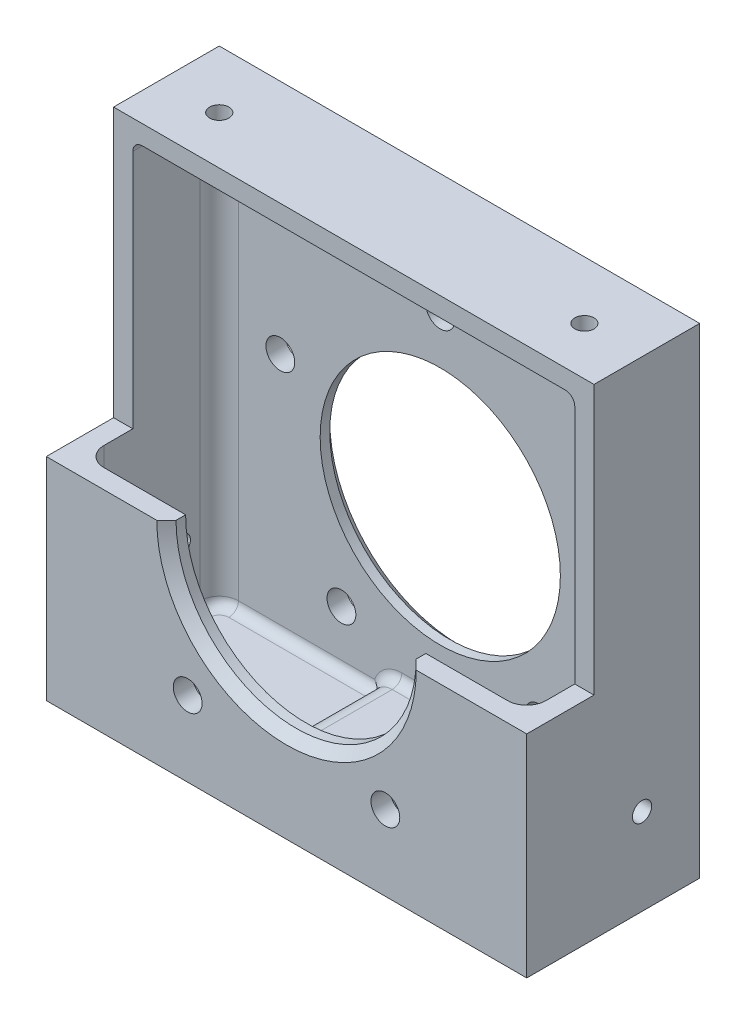
from build123d import *

# Parameters (mm, degrees)
SKETCH1_W          = 50
SKETCH1_H          = 50
MAIN_DEPTH         = 18
SKETCH2_W          = 7
SKETCH2_H          = 28
CUT_EXTRUDE1_DEPTH = 73.965745388
SHELL1_T           = -2
RIB1_REACH         = 72.285
SKETCH11_WALLS_W   = 12
SKETCH11_WALLS_H   = 158.570267126
SKETCH3_R          = 12.5
CUT_EXTRUDE2_DEPTH = 73.965745388
CHAMFER1_SIZE      = 1
CUT_EXTRUDE3_REACH = 74.966
SKETCH4_R          = 1
SKETCH6_R          = 1
CUT_EXTRUDE4_DEPTH = 73.965745388
CUT_EXTRUDE7_REACH = 74.966
SKETCH9_R          = 1.5
CIRPATTERN1_COUNT  = 5
CUT_EXTRUDE8_REACH = 74.966
SKETCH13_R         = 1.5
FILLET1_R          = 2
FILLET2_R          = 2
FILLET3_R          = 1


# Some blends are built 0.0001 mm under size
with BuildPart() as part:
    # Sketch1 → main (new body)
    with BuildSketch(Plane.XY):
        with Locations((25, 25)):
            Rectangle(SKETCH1_W, SKETCH1_H)
    extrude(amount=MAIN_DEPTH)

    # Sketch2 → Cut-Extrude1 (cut, through all)
    with BuildSketch(Plane(origin=(50, 0, 0), x_dir=(0, 0, -1), z_dir=(1, 0, 0))):
        with Locations((-14.5, 36)):
            Rectangle(SKETCH2_W, SKETCH2_H)
    extrude(amount=-CUT_EXTRUDE1_DEPTH, mode=Mode.SUBTRACT)

    # Shell1
    shell1_openings = [part.faces().sort_by_distance(p)[0] for p in [
        (25, 36, 11),
        (25, 22, 14.5),
    ]]
    offset(amount=SHELL1_T, openings=shell1_openings, kind=Kind.INTERSECTION)

    # Sketch11 walls → Rib1 (add, up to next)
    with BuildSketch(Plane(origin=(0, 4, 0), x_dir=(-1, 0, 0), z_dir=(0, 1, 0)), mode=Mode.PRIVATE) as rib1_sk1:
        with Locations((-25, 8)):
            Rectangle(SKETCH11_WALLS_W, SKETCH11_WALLS_H)
    rib1_tool1 = extrude(rib1_sk1.sketch, amount=-RIB1_REACH, mode=Mode.PRIVATE) - part.part
    add(rib1_tool1.solids().sort_by_distance((25, 4, 8))[0])

    # Sketch3 → Cut-Extrude2 (cut, through all)
    with BuildSketch(Plane.XY.offset(18)):
        with Locations((25, 22)):
            Circle(SKETCH3_R)
    extrude(amount=-CUT_EXTRUDE2_DEPTH, mode=Mode.SUBTRACT)

    # Chamfer1
    chamfer1_edges = [part.edges().sort_by_distance(p)[0] for p in [
        (12.5, 22, 0),
        (25, 9.5, 18),
    ]]
    chamfer(chamfer1_edges, length=CHAMFER1_SIZE)

    # Sketch4 → Cut-Extrude3 (cut, up to next)
    with BuildSketch(Plane(origin=(0, 50, 0), x_dir=(-1, 0, 0), z_dir=(0, 1, 0)), mode=Mode.PRIVATE) as cut_extrude3_sk1:
        with Locations((-44, 6)):
            Circle(SKETCH4_R)
    cut_extrude3_tool1 = extrude(cut_extrude3_sk1.sketch, amount=-CUT_EXTRUDE3_REACH, mode=Mode.PRIVATE) & part.part
    # Sketch4 → Cut-Extrude3 (cut, up to next)
    with BuildSketch(Plane(origin=(0, 50, 0), x_dir=(-1, 0, 0), z_dir=(0, 1, 0)), mode=Mode.PRIVATE) as cut_extrude3_sk2:
        with Locations(Location((-6, 6, 0), (0, 0, 180))):
            Circle(SKETCH4_R)
    cut_extrude3_tool2 = extrude(cut_extrude3_sk2.sketch, amount=-CUT_EXTRUDE3_REACH, mode=Mode.PRIVATE) & part.part
    add(cut_extrude3_tool1.solids().sort_by_distance((44, 50, 6))[0], mode=Mode.SUBTRACT)
    add(cut_extrude3_tool2.solids().sort_by_distance((6, 50, 6))[0], mode=Mode.SUBTRACT)

    # Sketch6 → Cut-Extrude4 (cut, through all)
    with BuildSketch(Plane(origin=(50, 0, 0), x_dir=(0, 0, -1), z_dir=(1, 0, 0))):
        with Locations(Location((-6, 9, 0), (0, 0, 90))):
            Circle(SKETCH6_R)
    extrude(amount=-CUT_EXTRUDE4_DEPTH, mode=Mode.SUBTRACT)

    # Sketch9 → Cut-Extrude7 (cut, up to next)
    with BuildSketch(Plane(origin=(0, 0, 0), x_dir=(-1, 0, 0), z_dir=(0, 0, -1)), mode=Mode.PRIVATE) as cut_extrude7_sk1:
        with Locations((-25, 39.5)):
            Circle(SKETCH9_R)
    cut_extrude7_tool1 = extrude(cut_extrude7_sk1.sketch, amount=-CUT_EXTRUDE7_REACH, mode=Mode.PRIVATE) & part.part
    cut_extrude7 = cut_extrude7_tool1.solids().sort_by_distance((25, 39.5, 0))[0]
    add(cut_extrude7, mode=Mode.SUBTRACT)

    # CirPattern1: Cut-Extrude7 ×5 about axis
    cirpattern1_axis = Axis((25, 22, 0), (0, 0, 1))
    for i in range(1, CIRPATTERN1_COUNT):
        add(cut_extrude7.rotate(cirpattern1_axis, i * 360 / CIRPATTERN1_COUNT), mode=Mode.SUBTRACT)

    # Sketch13 → Cut-Extrude8 (cut, up to next)
    with BuildSketch(Plane.XY.offset(18), mode=Mode.PRIVATE) as cut_extrude8_sk1:
        with Locations(Location((35.286241915, 7.842202598, 0), (0, 0, 180))):
            Circle(SKETCH13_R)
    cut_extrude8_tool1 = extrude(cut_extrude8_sk1.sketch, amount=-CUT_EXTRUDE8_REACH, mode=Mode.PRIVATE) & part.part
    # Sketch13 → Cut-Extrude8 (cut, up to next)
    with BuildSketch(Plane.XY.offset(18), mode=Mode.PRIVATE) as cut_extrude8_sk2:
        with Locations(Location((14.713758085, 7.842202598, 0), (0, 0, 180))):
            Circle(SKETCH13_R)
    cut_extrude8_tool2 = extrude(cut_extrude8_sk2.sketch, amount=-CUT_EXTRUDE8_REACH, mode=Mode.PRIVATE) & part.part
    add(cut_extrude8_tool1.solids().sort_by_distance((35.286242, 7.842203, 18))[0], mode=Mode.SUBTRACT)
    add(cut_extrude8_tool2.solids().sort_by_distance((14.713758, 7.842203, 18))[0], mode=Mode.SUBTRACT)

    # Fillet1
    fillet1_edges = [part.edges().sort_by_distance(p)[0] for p in [
        (2, 12, 16),
        (48, 12, 16),
        (2, 25, 2),
        (48, 25, 2),
    ]]
    fillet(fillet1_edges, radius=FILLET1_R)

    # Fillet2
    fillet2_edges = [part.edges().sort_by_distance(p)[0] for p in [
        (31, 4, 9),
        (19, 4, 9),
    ]]
    fillet(fillet2_edges, radius=FILLET2_R - 0.0001)  # a hair under: the kernel refuses the full size

    # Fillet3
    # the kernel refuses this fillet: 1 mm, written as the material it adds along each edge
    with BuildSketch(Plane(origin=(48, 2, 4), x_dir=(-1, 0, 0), z_dir=(0, 0, 1)), Plane(origin=(2, 2, 14), x_dir=(1, 0, 0), z_dir=(0, 0, -1))) as fillet3_piece_1:
        with BuildLine():
            CenterArc((FILLET3_R, -FILLET3_R), FILLET3_R, 90, 90)
            Line((0, -FILLET3_R), (0, 0))
            Line((0, 0), (FILLET3_R, 0))
        make_face()
    extrude(amount=10)
    with BuildSketch(Plane(origin=(46, 2, 14), x_dir=(1, 0, 0), z_dir=(0, 0, -1))) as fillet3_piece_2:
        with BuildLine():
            CenterArc((2 - FILLET3_R, -FILLET3_R), FILLET3_R, 360, 90)
            Line((2, -FILLET3_R), (2, 0))
            Line((2, 0), (2 - FILLET3_R, 0))
        make_face()
    revolve(axis=Axis((46, 2, 14), (0, -1, 0)), revolution_arc=90)
    with BuildSketch(Plane(origin=(46, 2, 4), x_dir=(0, 0, -1), z_dir=(-1, 0, 0))) as fillet3_piece_3:
        with BuildLine():
            CenterArc((2 - FILLET3_R, -FILLET3_R), FILLET3_R, 0, 90)
            Line((2, -FILLET3_R), (2, 0))
            Line((2, 0), (2 - FILLET3_R, 0))
        make_face()
    revolve(axis=Axis((46, 2, 4), (0, -1, 0)), revolution_arc=90)
    with BuildSketch(Plane(origin=(4, 2, 2), x_dir=(0, 0, 1), z_dir=(1, 0, 0)), Plane(origin=(4, 2, 16), x_dir=(0, 1, 0), z_dir=(1, 0, 0)), Plane(origin=(28.5, 2, 2), x_dir=(0, 0, 1), z_dir=(1, 0, 0)), Plane(origin=(28.5, 2, 16), x_dir=(0, 1, 0), z_dir=(1, 0, 0))) as fillet3_piece_4:
        with BuildLine():
            CenterArc((FILLET3_R, -FILLET3_R), FILLET3_R, 90, 90)
            Line((0, -FILLET3_R), (0, 0))
            Line((0, 0), (FILLET3_R, 0))
        make_face()
    extrude(amount=17.5)
    with BuildSketch(Plane(origin=(4, 48, 2), x_dir=(0, -1, 0), z_dir=(1, 0, 0))) as fillet3_piece_5:
        with BuildLine():
            CenterArc((FILLET3_R, -FILLET3_R), FILLET3_R, 90, 90)
            Line((0, -FILLET3_R), (0, 0))
            Line((0, 0), (FILLET3_R, 0))
        make_face()
    extrude(amount=42)
    with BuildSketch(Plane(origin=(4, 48, 4), x_dir=(0, 0, -1), z_dir=(1, 0, 0))) as fillet3_piece_6:
        with BuildLine():
            CenterArc((2 - FILLET3_R, -FILLET3_R), FILLET3_R, 0, 90)
            Line((2 - FILLET3_R, 0), (2, 0))
            Line((2, 0), (2, -FILLET3_R))
        make_face()
    revolve(axis=Axis((4, 48, 4), (0, 1, 0)), revolution_arc=90)
    with BuildSketch(Plane(origin=(46, 48, 4), x_dir=(0, 0, -1), z_dir=(-1, 0, 0))) as fillet3_piece_7:
        with BuildLine():
            CenterArc((2 - FILLET3_R, FILLET3_R), FILLET3_R, 270, 90)
            Line((2 - FILLET3_R, 0), (2, 0))
            Line((2, 0), (2, FILLET3_R))
        make_face()
    revolve(axis=Axis((46, 48, 4), (0, -1, 0)), revolution_arc=90)
    with BuildSketch(Plane(origin=(4, 2, 4), x_dir=(0, 0, -1), z_dir=(1, 0, 0))) as fillet3_piece_8:
        with BuildLine():
            CenterArc((2 - FILLET3_R, FILLET3_R), FILLET3_R, 270, 90)
            Line((2, FILLET3_R), (2, 0))
            Line((2, 0), (2 - FILLET3_R, 0))
        make_face()
    revolve(axis=Axis((4, 2, 4), (0, 1, 0)), revolution_arc=90)
    with BuildSketch(Plane(origin=(4, 2, 14), x_dir=(-1, 0, 0), z_dir=(0, 0, -1))) as fillet3_piece_9:
        with BuildLine():
            CenterArc((2 - FILLET3_R, FILLET3_R), FILLET3_R, 270, 90)
            Line((2, FILLET3_R), (2, 0))
            Line((2, 0), (2 - FILLET3_R, 0))
        make_face()
    revolve(axis=Axis((4, 2, 14), (0, 1, 0)), revolution_arc=90)
    with BuildSketch(Plane(origin=(20.9999, 4, 16), x_dir=(0, 1, 0), z_dir=(1, 0, 0)), Plane(origin=(20.9999, 4, 2), x_dir=(0, 0, 1), z_dir=(1, 0, 0))) as fillet3_piece_10:
        with BuildLine():
            CenterArc((FILLET3_R, -FILLET3_R), FILLET3_R, 90, 90)
            Line((0, -FILLET3_R), (0, 0))
            Line((0, 0), (FILLET3_R, 0))
        make_face()
    extrude(amount=8.0002)
    with BuildSketch(Plane(origin=(29.0001, 2.0001, 2), x_dir=(1, 0, 0), z_dir=(0, -1, 0))) as fillet3_piece_11:
        with BuildLine():
            CenterArc((1.9999 + FILLET3_R, FILLET3_R), FILLET3_R, 180, 90)
            Line((1.9999 + FILLET3_R, 0), (1.9999, 0))
            Line((1.9999, 0), (1.9999, FILLET3_R))
        make_face()
    revolve(axis=Axis((29.0001, 2.0001, 2), (0, 0, 1)), revolution_arc=90)
    with BuildSketch(Plane(origin=(29.0001, 2.0001, 16), x_dir=(1, 0, 0), z_dir=(0, -1, 0))) as fillet3_piece_12:
        with BuildLine():
            CenterArc((1.9999 + FILLET3_R, -FILLET3_R), FILLET3_R, 90, 90)
            Line((1.9999, -FILLET3_R), (1.9999, 0))
            Line((1.9999, 0), (1.9999 + FILLET3_R, 0))
        make_face()
    revolve(axis=Axis((29.0001, 2.0001, 16), (0, 0, 1)), revolution_arc=90)
    with BuildSketch(Plane(origin=(20.9999, 2.0001, 2), x_dir=(0, 1, 0), z_dir=(1, 0, 0))) as fillet3_piece_13:
        with BuildLine():
            CenterArc((1.9999 + FILLET3_R, FILLET3_R), FILLET3_R, 180, 90)
            Line((1.9999 + FILLET3_R, 0), (1.9999, 0))
            Line((1.9999, 0), (1.9999, FILLET3_R))
        make_face()
    revolve(axis=Axis((20.9999, 2.0001, 2), (0, 0, 1)), revolution_arc=90)
    with BuildSketch(Plane(origin=(20.9999, 2.0001, 16), x_dir=(0, 1, 0), z_dir=(1, 0, 0))) as fillet3_piece_14:
        with BuildLine():
            CenterArc((1.9999 + FILLET3_R, -FILLET3_R), FILLET3_R, 90, 90)
            Line((1.9999, -FILLET3_R), (1.9999, 0))
            Line((1.9999, 0), (1.9999 + FILLET3_R, 0))
        make_face()
    revolve(axis=Axis((20.9999, 2.0001, 16), (0, 0, 1)), revolution_arc=90)
    with BuildSketch(Plane(origin=(2, 48, 11), x_dir=(0, -1, 0), z_dir=(0, 0, -1)), Plane(origin=(48, 48, 4), x_dir=(0, -1, 0), z_dir=(0, 0, 1))) as fillet3_piece_15:
        with BuildLine():
            CenterArc((FILLET3_R, -FILLET3_R), FILLET3_R, 90, 90)
            Line((0, -FILLET3_R), (0, 0))
            Line((0, 0), (FILLET3_R, 0))
        make_face()
    extrude(amount=7)
    with BuildSketch(Plane(origin=(19, -0.5, 16), x_dir=(-1, 0, 0), z_dir=(0, 1, 0))) as fillet3_piece_16_section:
        with BuildLine():
            CenterArc((FILLET3_R, -FILLET3_R), FILLET3_R, 90, 90)
            Line((0, -FILLET3_R), (0, 0))
            Line((0, 0), (FILLET3_R, 0))
        make_face()
    fillet3_piece_16 = extrude(amount=2.5001, mode=Mode.PRIVATE)
    fillet3_piece_16 = split(fillet3_piece_16, bisect_by=Plane(origin=(18.776632061, 0, 15.776632061), z_dir=(0, 1, 0)), keep=Keep.TOP, mode=Mode.PRIVATE)
    add(fillet3_piece_16)
    with BuildSketch(Plane(origin=(19, -0.5, 2), x_dir=(0, 0, 1), z_dir=(0, 1, 0))) as fillet3_piece_17_section:
        with BuildLine():
            CenterArc((FILLET3_R, -FILLET3_R), FILLET3_R, 90, 90)
            Line((0, -FILLET3_R), (0, 0))
            Line((0, 0), (FILLET3_R, 0))
        make_face()
    fillet3_piece_17 = extrude(amount=2.5001, mode=Mode.PRIVATE)
    fillet3_piece_17 = split(fillet3_piece_17, bisect_by=Plane(origin=(18.776632061, 0, 2.223367939), z_dir=(0, 1, 0)), keep=Keep.TOP, mode=Mode.PRIVATE)
    add(fillet3_piece_17)
    with BuildSketch(Plane(origin=(31, 2.0001, 16), x_dir=(1, 0, 0), z_dir=(0, -1, 0))) as fillet3_piece_18_section:
        with BuildLine():
            CenterArc((FILLET3_R, -FILLET3_R), FILLET3_R, 90, 90)
            Line((0, -FILLET3_R), (0, 0))
            Line((0, 0), (FILLET3_R, 0))
        make_face()
    fillet3_piece_18 = extrude(amount=2.5001, mode=Mode.PRIVATE)
    fillet3_piece_18 = split(fillet3_piece_18, bisect_by=Plane(origin=(31.223367939, 0, 15.776632061), z_dir=(0, 1, 0)), keep=Keep.TOP, mode=Mode.PRIVATE)
    add(fillet3_piece_18)
    with BuildSketch(Plane(origin=(31, 2.0001, 2), x_dir=(0, 0, 1), z_dir=(0, -1, 0))) as fillet3_piece_19_section:
        with BuildLine():
            CenterArc((FILLET3_R, -FILLET3_R), FILLET3_R, 90, 90)
            Line((0, -FILLET3_R), (0, 0))
            Line((0, 0), (FILLET3_R, 0))
        make_face()
    fillet3_piece_19 = extrude(amount=2.5001, mode=Mode.PRIVATE)
    fillet3_piece_19 = split(fillet3_piece_19, bisect_by=Plane(origin=(31.223367939, 0, 2.223367939), z_dir=(0, 1, 0)), keep=Keep.TOP, mode=Mode.PRIVATE)
    add(fillet3_piece_19)


solid = part.part
